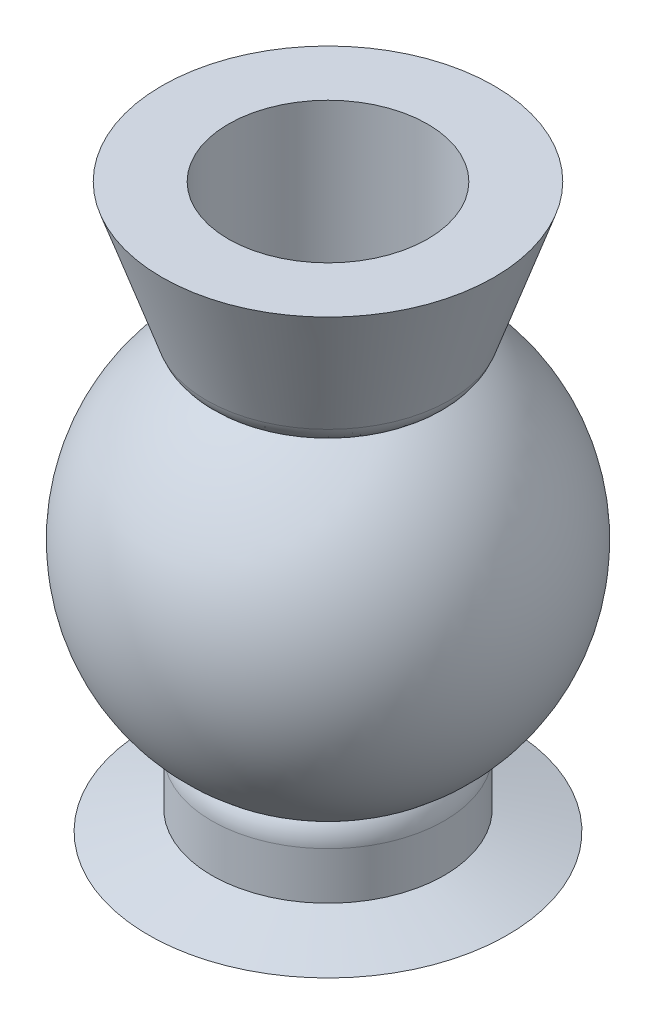
from build123d import *

# Parameters (mm, degrees)
ESQUISSE5_R             = 1.5
ENL_V_MAT_EXTRU_2_DEPTH = 10.476995662
CONG_2_R                = 0.5


with BuildPart() as part:
    # Esquisse1 → Révolution1 (revolve)
    with BuildSketch(Plane.XY):
        with BuildLine():
            Line((0, -3), (0, 3))
            ThreePointArc((0, 3), (3, 0), (0, -3))
        make_face()
    revolve(axis=Axis((0, 3, 0), (0, -1, 0)))

    # Esquisse4 → Révolution2 (revolve)
    with BuildSketch(Plane.XY, mode=Mode.PRIVATE) as r_volution2_sk:
        Polygon((1.75, 2.5), (2.5, 4.674281491), (0, 4.674281491), (0, 2.5), align=None)
    revolve(r_volution2_sk.sketch.rotate(Axis((0, -3.615713826, 0), (0, 1, 0)), 90), axis=Axis((0, -3.615713826, 0), (0, 1, 0)))

    # Esquisse6 → Révolution3 (revolve)
    with BuildSketch(Plane.XY, mode=Mode.PRIVATE) as r_volution3_sk:
        Polygon((0, -2.5), (1.75, -2.5), (1.75, -3.5), (2.703939201, -3.8), (0, -3.8), align=None)
    revolve(r_volution3_sk.sketch.rotate(Axis((0, -4.241210253, 0), (0, 1, 0)), 90), axis=Axis((0, -4.241210253, 0), (0, 1, 0)))

    # Esquisse5 → Enlèv. mat.-Extru.2 (cut, through all)
    with BuildSketch(Plane(origin=(0, 4.674281491, 0), x_dir=(1, 0, 0), z_dir=(0, 1, 0))):
        with Locations(Location((0, 0, 0), (0, 0, 270))):
            Circle(ESQUISSE5_R)
    extrude(amount=-ENL_V_MAT_EXTRU_2_DEPTH, mode=Mode.SUBTRACT)

    # Congé2
    # the kernel refuses this fillet: 0.5 mm, written as the material it takes off along each edge
    with BuildSketch(Plane(origin=(0, -2.5, 0), x_dir=(0, 0, -1), z_dir=(1, 0, 0))) as cong_2_piece_1:
        with BuildLine():
            CenterArc((1.25, -0.288584455), CONG_2_R, 0, 35.251664283)
            Line((1.75, -0.288584455), (1.75, 0))
            Line((1.75, 0), (1.658312395, 0))
        make_face()
    revolve(axis=Axis((0, -2.5, 0), (0, 1, 0)), mode=Mode.SUBTRACT)
    with BuildSketch(Plane(origin=(0, 2.5, 0), x_dir=(0, 0, -1), z_dir=(1, 0, 0))) as cong_2_piece_2:
        with BuildLine():
            CenterArc((1.359328414, 0.400760002), CONG_2_R, 306.724501908, 34.244057167)
            Line((1.831998303, 0.237716523), (1.75, 0))
            Line((1.75, 0), (1.658312395, 0))
        make_face()
    revolve(axis=Axis((0, 2.5, 0), (0, 1, 0)), mode=Mode.SUBTRACT)


solid = part.part
